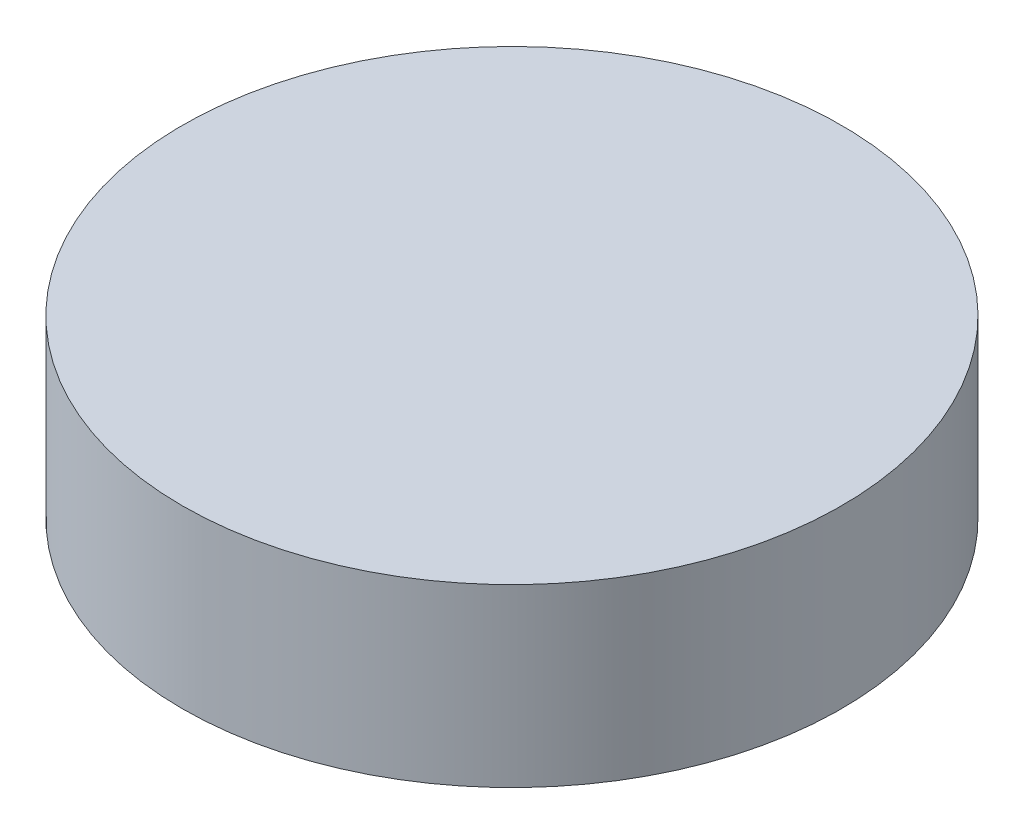
from build123d import *

# Parameters (mm, degrees)
SKETCH1_R           = 37.5
BOSS_EXTRUDE1_DEPTH = 20


with BuildPart() as part:
    # Sketch1 → Boss-Extrude1 (new body)
    with BuildSketch(Plane(origin=(0, 0, 0), x_dir=(1, 0, 0), z_dir=(0, 1, 0))):
        Circle(SKETCH1_R)
    extrude(amount=BOSS_EXTRUDE1_DEPTH)


solid = part.part
